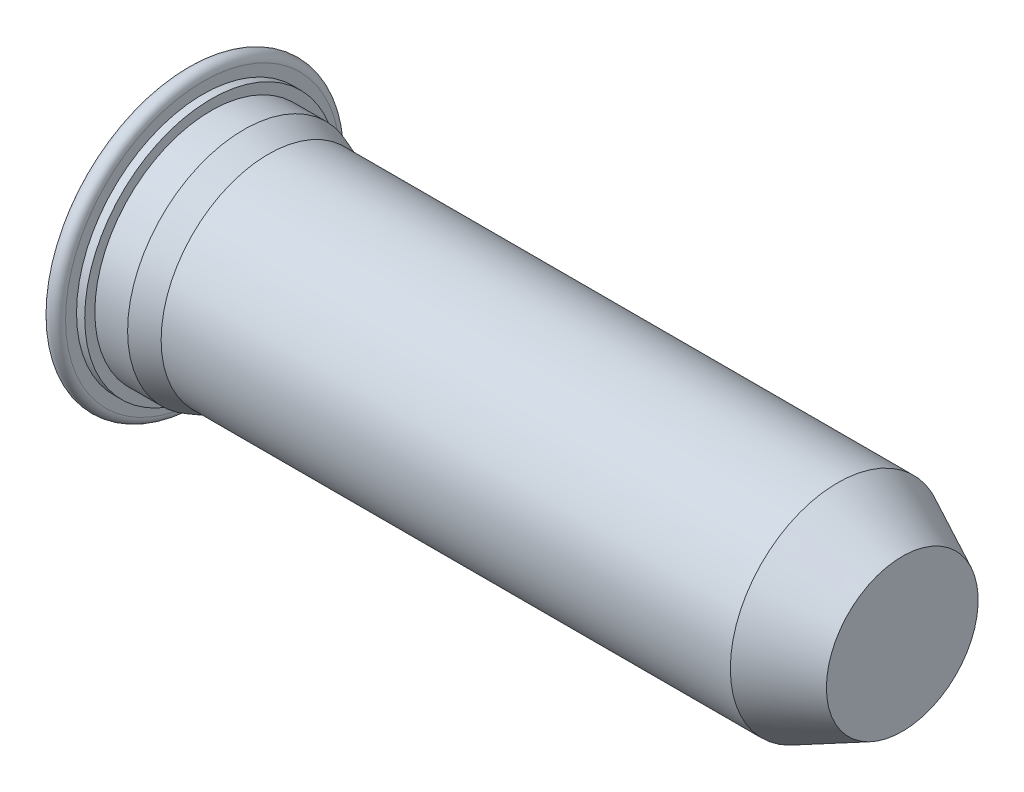
from build123d import *


with BuildPart() as part:
    # BodySke → BaseBody (revolve)
    with BuildSketch(Plane.XY):
        with BuildLine():
            Line((0, 0), (0, 3.83346))
            Line((0, 3.83346), (0.00508, 3.83346))
            Line((0.00508, 3.83346), (0.00508, 3.83854))
            ThreePointArc((0.00508, 3.83854), (0.23154, 4.065), (0.458, 3.83854))
            Line((0.458, 3.83854), (0.458, 3.5325))
            Line((0.458, 3.5325), (0.687, 3.5325))
            Line((0.687, 3.5325), (0.687, 3.25))
            Line((0.687, 3.25), (1.603130645, 3.25))
            Line((1.603130645, 3.25), (2.29, 3))
            Line((2.29, 3), (18.195732619, 3))
            Line((18.195732619, 3), (20, 2.12))
            Line((20, 2.12), (20, 0))
            Line((20, 0), (0, 0))
        make_face()
    revolve(axis=Axis((0, 0, 0), (1, 0, 0)))


solid = part.part
